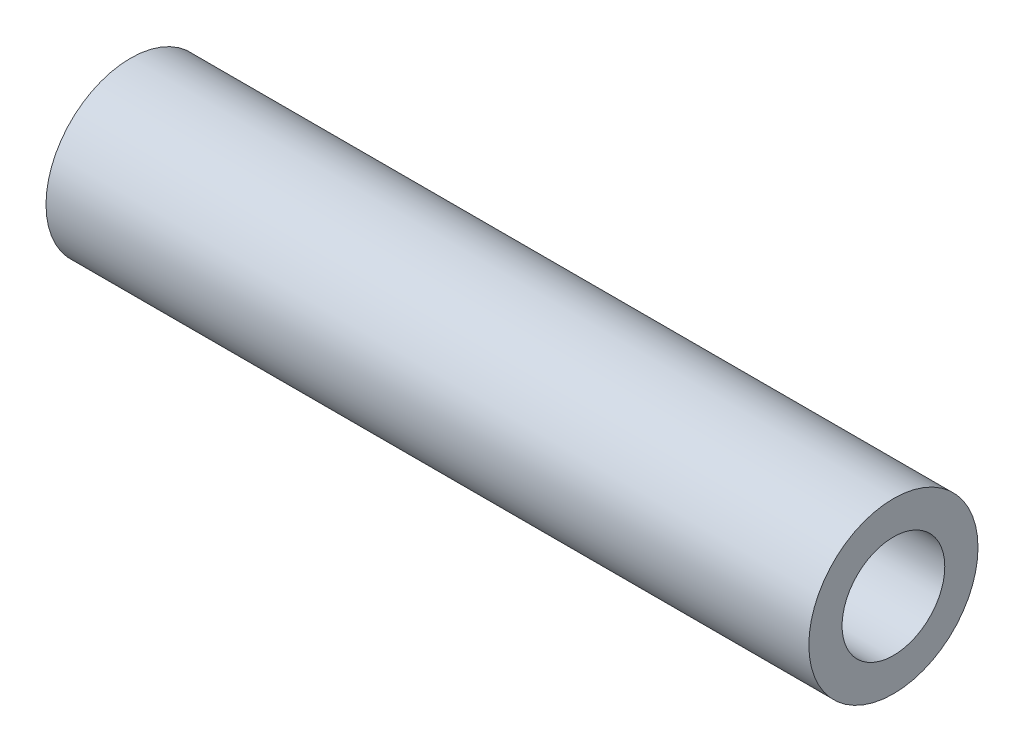
from build123d import *

# Parameters (mm, degrees)
SKETCH1_R           = 47.675
SKETCH1_R_2         = 28.95
BOSS_EXTRUDE1_DEPTH = 430


with BuildPart() as part:
    # Sketch1 → Boss-Extrude1 (new body)
    with BuildSketch(Plane(origin=(0, 0, 0), x_dir=(0, 0, -1), z_dir=(1, 0, 0))):
        Circle(SKETCH1_R)
        Circle(SKETCH1_R_2, mode=Mode.SUBTRACT)
    extrude(amount=BOSS_EXTRUDE1_DEPTH)


solid = part.part
